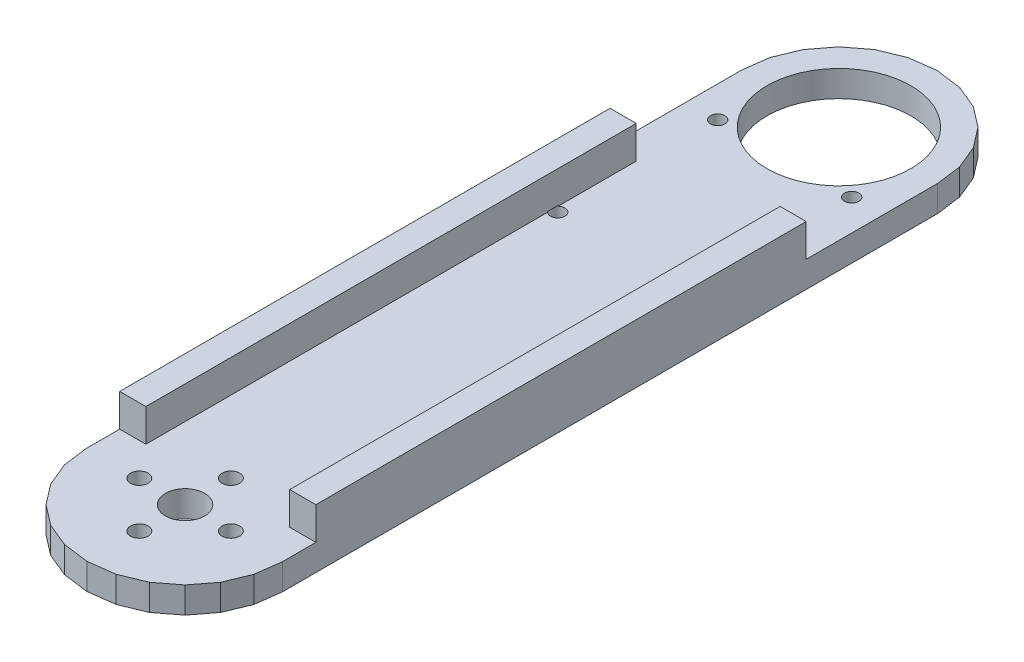
from build123d import *

# Parameters (mm, degrees)
BOSS_1_DEPTH  = 4
S_BOX2_W      = 4
S_BOX2_H      = 5.5
BOSS_2_DEPTH  = 75
S_BOX3_W      = 4
S_BOX3_H      = 5.5
BOSS_3_DEPTH  = 75
S_HOLE4_R     = 3
HOLE_4_DEPTH  = 4.2
S_HOLE5_R     = 1.35
HOLE_5_DEPTH  = 4.2
S_HOLE6_R     = 1.35
HOLE_6_DEPTH  = 4.2
S_HOLE7_R     = 1.35
HOLE_7_DEPTH  = 4.2
S_HOLE8_R     = 1.35
HOLE_8_DEPTH  = 4.2
S_HOLE9_R     = 11
HOLE_9_DEPTH  = 4.2
S_HOLE10_R    = 1.1
HOLE_10_DEPTH = 4.2
S_HOLE11_R    = 1.1
HOLE_11_DEPTH = 4.2
S_HOLE12_R    = 1.1
HOLE_12_DEPTH = 4.2
S_HOLE13_R    = 1.1
HOLE_13_DEPTH = 4.2


with BuildPart() as part:
    # S_prism1 → Boss_1 (new body)
    with BuildSketch(Plane(origin=(0, 18.625, 0), x_dir=(1, 0, 0), z_dir=(0, 1, 0))):
        Polygon((-15, -0.1), (-14.492, -3.956), (-13.004, -7.55), (-10.636, -10.636), (-7.55, -13.004), (-3.956, -14.492), (-0.1, -15), (0.1, -15), (3.956, -14.492), (7.55, -13.004), (10.636, -10.636), (13.004, -7.55), (14.492, -3.956), (15, -0.1), (15, 100.1), (14.492, 103.956), (13.004, 107.55), (10.636, 110.636), (7.55, 113.004), (3.956, 114.492), (0.1, 115), (-0.1, 115), (-3.956, 114.492), (-7.55, 113.004), (-10.636, 110.636), (-13.004, 107.55), (-14.492, 103.956), (-15, 100.1), align=None)
    extrude(amount=BOSS_1_DEPTH)

    # S_box2 → Boss_2 (add)
    with BuildSketch(Plane.XY.offset(-80)):
        with Locations((-13, 24.875)):
            Rectangle(S_BOX2_W, S_BOX2_H)
    extrude(amount=BOSS_2_DEPTH)

    # S_box3 → Boss_3 (add)
    with BuildSketch(Plane.XY.offset(-80)):
        with Locations((13, 24.875)):
            Rectangle(S_BOX3_W, S_BOX3_H)
    extrude(amount=BOSS_3_DEPTH)

    # S_hole4 → Hole_4 (cut)
    with BuildSketch(Plane(origin=(0, 18.525, 0), x_dir=(1, 0, 0), z_dir=(0, 1, 0))):
        Circle(S_HOLE4_R)
    extrude(amount=HOLE_4_DEPTH, mode=Mode.SUBTRACT)

    # S_hole5 → Hole_5 (cut)
    with BuildSketch(Plane(origin=(0, 18.525, 0), x_dir=(1, 0, 0), z_dir=(0, 1, 0))):
        with Locations((7, 0)):
            Circle(S_HOLE5_R)
    extrude(amount=HOLE_5_DEPTH, mode=Mode.SUBTRACT)

    # S_hole6 → Hole_6 (cut)
    with BuildSketch(Plane(origin=(0, 18.525, 0), x_dir=(1, 0, 0), z_dir=(0, 1, 0))):
        with Locations((0, -7)):
            Circle(S_HOLE6_R)
    extrude(amount=HOLE_6_DEPTH, mode=Mode.SUBTRACT)

    # S_hole7 → Hole_7 (cut)
    with BuildSketch(Plane(origin=(0, 18.525, 0), x_dir=(1, 0, 0), z_dir=(0, 1, 0))):
        with Locations((-7, 0)):
            Circle(S_HOLE7_R)
    extrude(amount=HOLE_7_DEPTH, mode=Mode.SUBTRACT)

    # S_hole8 → Hole_8 (cut)
    with BuildSketch(Plane(origin=(0, 18.525, 0), x_dir=(1, 0, 0), z_dir=(0, 1, 0))):
        with Locations((0, 7)):
            Circle(S_HOLE8_R)
    extrude(amount=HOLE_8_DEPTH, mode=Mode.SUBTRACT)

    # S_hole9 → Hole_9 (cut)
    with BuildSketch(Plane(origin=(0, 18.525, 0), x_dir=(1, 0, 0), z_dir=(0, 1, 0))):
        with Locations((0, 100)):
            Circle(S_HOLE9_R)
    extrude(amount=HOLE_9_DEPTH, mode=Mode.SUBTRACT)

    # S_hole10 → Hole_10 (cut)
    with BuildSketch(Plane(origin=(0, 18.525, 0), x_dir=(1, 0, 0), z_dir=(0, 1, 0))):
        with Locations((-10.25, 91.7)):
            Circle(S_HOLE10_R)
    extrude(amount=HOLE_10_DEPTH, mode=Mode.SUBTRACT)

    # S_hole11 → Hole_11 (cut)
    with BuildSketch(Plane(origin=(0, 18.525, 0), x_dir=(1, 0, 0), z_dir=(0, 1, 0))):
        with Locations((10.25, 91.7)):
            Circle(S_HOLE11_R)
    extrude(amount=HOLE_11_DEPTH, mode=Mode.SUBTRACT)

    # S_hole12 → Hole_12 (cut)
    with BuildSketch(Plane(origin=(0, 18.525, 0), x_dir=(1, 0, 0), z_dir=(0, 1, 0))):
        with Locations((-10.25, 67.25)):
            Circle(S_HOLE12_R)
    extrude(amount=HOLE_12_DEPTH, mode=Mode.SUBTRACT)

    # S_hole13 → Hole_13 (cut)
    with BuildSketch(Plane(origin=(0, 18.525, 0), x_dir=(1, 0, 0), z_dir=(0, 1, 0))):
        with Locations((10.25, 67.25)):
            Circle(S_HOLE13_R)
    extrude(amount=HOLE_13_DEPTH, mode=Mode.SUBTRACT)


solid = part.part
